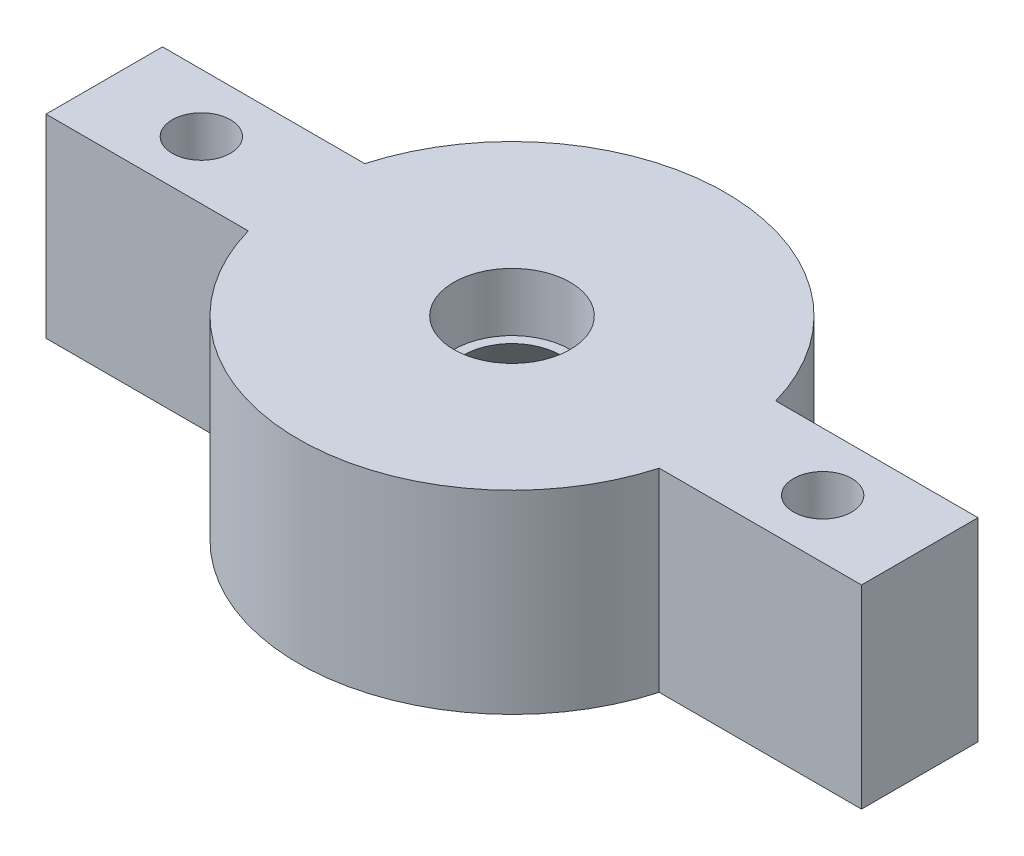
from build123d import *

# Parameters (mm, degrees)
SKETCH2_W           = 6
SKETCH2_H           = 10
BOSS_EXTRUDE1_DEPTH = 42
SKETCH3_R           = 11
BOSS_EXTRUDE2_DEPTH = 10
SKETCH4_R           = 7.5
CUT_EXTRUDE1_DEPTH  = 2
SKETCH6_R           = 3
CUT_EXTRUDE2_DEPTH  = 13
FILLET1_R           = 2
CUT_EXTRUDE3_REACH  = 46.553
SKETCH7_R           = 1.5


with BuildPart() as part:
    # Sketch2 → Boss-Extrude1 (new body)
    with BuildSketch(Plane(origin=(0, 0, 0), x_dir=(0, 0, -1), z_dir=(1, 0, 0))):
        Rectangle(SKETCH2_W, SKETCH2_H)
    extrude(amount=BOSS_EXTRUDE1_DEPTH)

    # Sketch3 → Boss-Extrude2 (add)
    with BuildSketch(Plane(origin=(0, 5, 0), x_dir=(1, 0, 0), z_dir=(0, 1, 0))):
        with Locations((21, 0)):
            Circle(SKETCH3_R)
    extrude(amount=-BOSS_EXTRUDE2_DEPTH)

    # Sketch4 → Cut-Extrude1 (cut)
    with BuildSketch(Plane(origin=(0, -5, 0), x_dir=(-1, 0, 0), z_dir=(0, -1, 0))):
        with Locations(Location((-21, 0, 0), (0, 0, 90))):
            Circle(SKETCH4_R)
    extrude(amount=-CUT_EXTRUDE1_DEPTH, mode=Mode.SUBTRACT)

    # Sketch5 → Cut-Revolve1 (revolve, cut)
    with BuildSketch(Plane(origin=(0, 0, 0), x_dir=(-1, 0, 0), z_dir=(0, 0, -1)), mode=Mode.PRIVATE) as cut_revolve1_sk:
        Polygon((-21, -3), (-28.5, -3), (-23.5, 2), (-21, 2), align=None)
    revolve(cut_revolve1_sk.sketch.rotate(Axis((21, 2, 0), (0, -1, 0)), 270), axis=Axis((21, 2, 0), (0, -1, 0)), mode=Mode.SUBTRACT)

    # Sketch6 → Cut-Extrude2 (cut)
    with BuildSketch(Plane.XZ.offset(-2)):
        with Locations(Location((21, 0, 0), (0, 0, 270))):
            Circle(SKETCH6_R)
    extrude(amount=-CUT_EXTRUDE2_DEPTH, mode=Mode.SUBTRACT)

    # Fillet1
    fillet1_edges = [part.edges().sort_by_distance(p)[0] for p in [
        (21, -5, 7.5),
    ]]
    fillet(fillet1_edges, radius=FILLET1_R - 0.0001)  # a hair under: the kernel refuses the full size

    # Sketch7 → Cut-Extrude3 (cut, up to next)
    with BuildSketch(Plane.XZ.offset(5), mode=Mode.PRIVATE) as cut_extrude3_sk1:
        with Locations(Location((5, 0, 0), (0, 0, 270))):
            Circle(SKETCH7_R)
    cut_extrude3_tool1 = extrude(cut_extrude3_sk1.sketch, amount=-CUT_EXTRUDE3_REACH, mode=Mode.PRIVATE) & part.part
    # Sketch7 → Cut-Extrude3 (cut, up to next)
    with BuildSketch(Plane.XZ.offset(5), mode=Mode.PRIVATE) as cut_extrude3_sk2:
        with Locations(Location((37, 0, 0), (0, 0, 270))):
            Circle(SKETCH7_R)
    cut_extrude3_tool2 = extrude(cut_extrude3_sk2.sketch, amount=-CUT_EXTRUDE3_REACH, mode=Mode.PRIVATE) & part.part
    add(cut_extrude3_tool1.solids().sort_by_distance((5, -5, 0))[0], mode=Mode.SUBTRACT)
    add(cut_extrude3_tool2.solids().sort_by_distance((37, -5, 0))[0], mode=Mode.SUBTRACT)


solid = part.part
